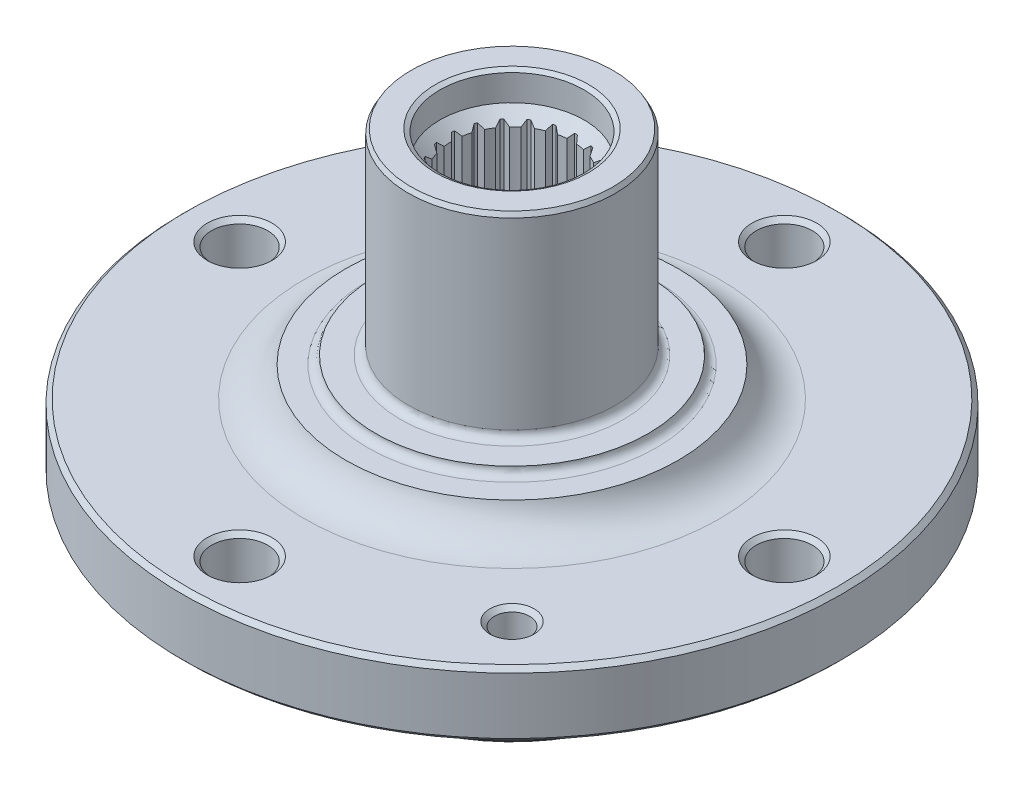
from build123d import *
from OCP.BRepFilletAPI import BRepFilletAPI_MakeChamfer

# Parameters (mm, degrees)
SKETCH2_R          = 5.15
SKETCH2_R_2        = 3.25
CUT_EXTRUDE1_DEPTH = 20
CHAMFER6_SIZE      = 1
CHAMFER7_SIZE      = 2.5
CUT_EXTRUDE4_DEPTH = 100
CHAMFER1_SIZE      = 0.8
CHAMFER2_SIZE      = 0.8
FILLET1_R          = 2
FILLET2_R          = 1.5
CHAMFER3_SIZE      = 0.5
FILLET3_R          = 8
FILLET4_R          = 1.5
FILLET5_R          = 1.5
CHAMFER5_SIZE      = 0.8
CHAMFER5_SIZE2     = 0.461880215


# Some blends are built 0.0001 mm under size
with BuildPart() as part:
    # Sketch1 → Revolve1 (revolve)
    with BuildSketch(Plane.XY, mode=Mode.PRIVATE) as revolve1_sk:
        Polygon((13.25, 37.5), (13.25, 32.5), (11, 32.5), (11, -18.5), (25.5, -18.5), (25.5, -34.5), (28, -34.5), (28, -39.5), (29.5, -39.5), (29.5, -35), (30, -35), (30, -26), (30.25, -26), (30.25, -17.5), (60.5, -17.5), (60.5, -5.5), (30.5, -5.5), (30.5, 0), (25, 0), (25, 1.5), (19, 1.5), (19, 37.5), align=None)
    revolve(revolve1_sk.sketch.rotate(Axis((0, 72.237951583, 0), (0, -1, 0)), 180), axis=Axis((0, 72.237951583, 0), (0, -1, 0)))

    # Sketch2 → Cut-Extrude1 (cut)
    with BuildSketch(Plane.XZ.offset(17.5)):
        with Locations((-50, 0)):
            Circle(SKETCH2_R)
        with Locations((35.355339059, 35.355339059)):
            Circle(SKETCH2_R_2)
        with Locations((0, 50)):
            Circle(SKETCH2_R)
        with Locations((50, 0)):
            Circle(SKETCH2_R)
        with Locations((-35.355339059, -35.355339059)):
            Circle(SKETCH2_R_2)
        with Locations((0, -50)):
            Circle(SKETCH2_R)
    extrude(amount=-CUT_EXTRUDE1_DEPTH, mode=Mode.SUBTRACT)

    # Chamfer6
    chamfer6_edges = [part.edges().sort_by_distance(p)[0] for p in [
        (11, -18.5, 0),
    ]]
    chamfer(chamfer6_edges, length=CHAMFER6_SIZE)

    # Chamfer7
    # the kernel refuses this chamfer: 2.5 mm, written as the material it takes off along each edge
    with BuildSketch(Plane(origin=(0, 32.5, 0), x_dir=(-1, 0, 0), z_dir=(0, 0, 1))) as chamfer7_piece_1_section:
        Polygon((11, CHAMFER7_SIZE), (11 + CHAMFER7_SIZE, 0), (11, 0), align=None)
    chamfer7_piece_1 = revolve(axis=Axis((0, 32.5, 0), (0, -1, 0)), mode=Mode.PRIVATE)
    chamfer7_piece_1 = chamfer7_piece_1 & Plane(origin=(0, 31.134199325, 0), x_dir=(-1, 0, 0), z_dir=(0, -1, 0)) * Cylinder(13.25, 54, mode=Mode.PRIVATE)
    add(chamfer7_piece_1, mode=Mode.SUBTRACT)

    # Sketch3 → Cut-Extrude4 (cut)
    with BuildSketch(Plane.XZ.offset(18.5)):
        with BuildLine():
            Line((1.499612388, 11.654475596), (0.215435269, 10.491079369))
            ThreePointArc((0.215435269, 10.491079369), (1.563455316, 10.376109275), (2.885474644, 10.088635686))
            Line((2.885474644, 10.088635686), (2.001266969, 11.578863334))
            ThreePointArc((2.001266969, 11.578863334), (1.750847811, 11.619377243), (1.499612388, 11.654475596))
        make_face()
        with BuildLine():
            Line((4.868337941, 10.694643685), (3.298296151, 9.961451739))
            ThreePointArc((3.298296151, 9.961451739), (4.552539419, 9.45425356), (5.73109081, 8.789879578))
            Line((5.73109081, 8.789879578), (5.325418312, 10.47452538))
            ThreePointArc((5.325418312, 10.47452538), (5.098066258, 10.587051713), (4.868337941, 10.694643685))
        make_face()
        with BuildLine():
            Line((7.804485048, 8.784505125), (6.088083689, 8.546664781))
            ThreePointArc((6.088083689, 8.546664781), (7.137105161, 7.692305301), (8.067469151, 6.71006347))
            Line((8.067469151, 6.71006347), (8.176377611, 8.439439254))
            ThreePointArc((8.176377611, 8.439439254), (7.99229389, 8.613979552), (7.804485048, 8.784505125))
        make_face()
        with BuildLine():
            Line((10.047164153, 6.093784109), (8.336913018, 6.372428526))
            ThreePointArc((8.336913018, 6.372428526), (9.087502531, 5.246821334), (9.687012198, 4.033988151))
            Line((9.687012198, 4.033988151), (10.300824621, 5.654431289))
            ThreePointArc((10.300824621, 5.654431289), (10.176365879, 5.875476881), (10.047164153, 6.093784109))
        make_face()
        with BuildLine():
            Line((11.397103375, 2.861563007), (9.844965783, 3.631933407))
            ThreePointArc((9.844965783, 3.631933407), (10.230430166, 2.335093641), (10.445816444, 0.999434657))
            Line((10.445816444, 0.999434657), (11.509992904, 2.366961665))
            ThreePointArc((11.509992904, 2.366961665), (11.456217846, 2.61487168), (11.397103375, 2.861563007))
        make_face()
        with BuildLine():
            Line((11.73435469, -0.62496115), (10.478244879, 0.56868444))
            ThreePointArc((10.478244879, 0.56868444), (10.464333929, -0.784157995), (10.276458802, -2.123963618))
            Line((10.276458802, -2.123963618), (11.696442549, -1.130863515))
            ThreePointArc((11.696442549, -1.130863515), (11.718129326, -0.878116971), (11.73435469, -0.62496115))
        make_face()
        with BuildLine():
            Line((11.02895184, -4.055995392), (10.180480677, -2.54513526))
            ThreePointArc((10.180480677, -2.54513526), (9.768430444, -3.833774377), (9.193987442, -5.058679029))
            Line((9.193987442, -5.058679029), (10.843606689, -4.528247135))
            ThreePointArc((10.843606689, -4.528247135), (10.938828335, -4.2931217), (11.02895184, -4.055995392))
        make_face()
        with BuildLine():
            Line((9.343572963, -7.12667727), (8.978130835, -5.432849148))
            ThreePointArc((8.978130835, -5.432849148), (8.20455379, -6.542783707), (7.294584694, -7.543949235))
            Line((7.294584694, -7.543949235), (9.027263532, -7.52331675))
            ThreePointArc((9.027263532, -7.52331675), (9.187559186, -7.326704352), (9.343572963, -7.12667727))
        make_face()
        with BuildLine():
            Line((6.827971368, -9.564163222), (6.978029411, -7.837871173))
            ThreePointArc((6.978029411, -7.837871173), (5.91166127, -8.670478617), (4.747020828, -9.35894707))
            Line((4.747020828, -9.35894707), (6.408803138, -9.849947282))
            ThreePointArc((6.408803138, -9.849947282), (6.619929828, -9.709317794), (6.827971368, -9.564163222))
        make_face()
        with BuildLine():
            Line((3.705669296, -11.151871926), (4.357894196, -9.546504574))
            ThreePointArc((4.357894196, -9.546504574), (3.093486447, -10.027804077), (1.777658073, -10.342402012))
            Line((1.777658073, -10.342402012), (3.220887205, -11.301407397))
            ThreePointArc((3.220887205, -11.301407397), (3.464085398, -11.229256367), (3.705669296, -11.151871926))
        make_face()
        with BuildLine():
            Line((0.25409699, -11.748728495), (1.350535701, -10.406929774))
            ThreePointArc((1.350535701, -10.406929774), (0.000436521, -10.494155764), (-1.349662659, -10.406929774))
            Line((-1.349662659, -10.406929774), (-0.253223947, -11.748728495))
            ThreePointArc((-0.253223947, -11.748728495), (0.000436521, -11.751466858), (0.25409699, -11.748728495))
        make_face()
        with BuildLine():
            Line((-3.220058206, -11.301699604), (-1.776829074, -10.342694219))
            ThreePointArc((-1.776829074, -10.342694219), (-3.092657447, -10.028096284), (-4.357065197, -9.54679678))
            Line((-4.357065197, -9.54679678), (-3.704840297, -11.152164132))
            ThreePointArc((-3.704840297, -11.152164132), (-3.463256398, -11.229548574), (-3.220058206, -11.301699604))
        make_face()
        with BuildLine():
            Line((-6.408102355, -9.850505732), (-4.746320045, -9.35950552))
            ThreePointArc((-4.746320045, -9.35950552), (-5.910960486, -8.671037067), (-6.977328628, -7.838429623))
            Line((-6.977328628, -7.838429623), (-6.827270584, -9.564721672))
            ThreePointArc((-6.827270584, -9.564721672), (-6.619229045, -9.709876244), (-6.408102355, -9.850505732))
        make_face()
        with BuildLine():
            Line((-9.026763745, -7.524091822), (-7.294084907, -7.544724307))
            ThreePointArc((-7.294084907, -7.544724307), (-8.204054002, -6.543558779), (-8.977631047, -5.43362422))
            Line((-8.977631047, -5.43362422), (-9.343073175, -7.127452342))
            ThreePointArc((-9.343073175, -7.127452342), (-9.187059399, -7.327479424), (-9.026763745, -7.524091822))
        make_face()
        with BuildLine():
            Line((-10.843362819, -4.529169961), (-9.193743572, -5.059601855))
            ThreePointArc((-9.193743572, -5.059601855), (-9.768186574, -3.834697203), (-10.180236807, -2.546058086))
            Line((-10.180236807, -2.546058086), (-11.02870797, -4.056918218))
            ThreePointArc((-11.02870797, -4.056918218), (-10.938584465, -4.294044526), (-10.843362819, -4.529169961))
        make_face()
        with BuildLine():
            Line((-11.696486777, -1.131852098), (-10.27650303, -2.1249522))
            ThreePointArc((-10.27650303, -2.1249522), (-10.464378157, -0.785146578), (-10.478289107, 0.567695858))
            Line((-10.478289107, 0.567695858), (-11.734398918, -0.625949733))
            ThreePointArc((-11.734398918, -0.625949733), (-11.718173554, -0.879105553), (-11.696486777, -1.131852098))
        make_face()
        with BuildLine():
            Line((-11.510331813, 2.365995166), (-10.446155353, 0.998468158))
            ThreePointArc((-10.446155353, 0.998468158), (-10.230769075, 2.334127141), (-9.845304693, 3.630966907))
            Line((-9.845304693, 3.630966907), (-11.397442284, 2.860596508))
            ThreePointArc((-11.397442284, 2.860596508), (-11.456556755, 2.61390518), (-11.510331813, 2.365995166))
        make_face()
        with BuildLine():
            Line((-10.301438611, 5.653572751), (-9.687626187, 4.033129613))
            ThreePointArc((-9.687626187, 4.033129613), (-9.088116521, 5.245962796), (-8.337527008, 6.371569988))
            Line((-8.337527008, 6.371569988), (-10.047778142, 6.092925571))
            ThreePointArc((-10.047778142, 6.092925571), (-10.176979869, 5.874618343), (-10.301438611, 5.653572751))
        make_face()
        with BuildLine():
            Line((-8.177222637, 8.438764962), (-8.068314177, 6.709389178))
            ThreePointArc((-8.068314177, 6.709389178), (-7.137950187, 7.691631009), (-6.088928715, 8.545990489))
            Line((-6.088928715, 8.545990489), (-7.805330075, 8.783830833))
            ThreePointArc((-7.805330075, 8.783830833), (-7.993138916, 8.61330526), (-8.177222637, 8.438764962))
        make_face()
        with BuildLine():
            Line((-5.326429804, 10.474095247), (-5.732102302, 8.789449445))
            ThreePointArc((-5.732102302, 8.789449445), (-4.553550911, 9.453823427), (-3.299307643, 9.961021606))
            Line((-3.299307643, 9.961021606), (-4.869349433, 10.694213552))
            ThreePointArc((-4.869349433, 10.694213552), (-5.09907775, 10.58662158), (-5.326429804, 10.474095247))
        make_face()
        with BuildLine():
            Line((-2.002365563, 11.57871558), (-2.886573238, 10.088487932))
            ThreePointArc((-2.886573238, 10.088487932), (-1.56455391, 10.375961521), (-0.216533863, 10.490931615))
            Line((-0.216533863, 10.490931615), (-1.500710982, 11.654327842))
            ThreePointArc((-1.500710982, 11.654327842), (-1.751946405, 11.619229489), (-2.002365563, 11.57871558))
        make_face()
    extrude(amount=-CUT_EXTRUDE4_DEPTH, mode=Mode.SUBTRACT)

    # Chamfer1
    chamfer1_edges = [part.edges().sort_by_distance(p)[0] for p in [
        (-55.15, -5.5, 0),
        (-55.15, -17.5, 0),
        (32.105339059, -5.5, 35.355339059),
        (-38.605339059, -5.5, -35.355339059),
        (-38.605339059, -17.5, -35.355339059),
        (-5.15, -5.5, 50),
        (-5.15, -17.5, 50),
        (44.85, -5.5, 0),
        (44.85, -17.5, 0),
        (-5.15, -5.5, -50),
        (-5.15, -17.5, -50),
    ]]
    chamfer(chamfer1_edges, length=CHAMFER1_SIZE)

    # Chamfer2
    chamfer2_edges = [part.edges().sort_by_distance(p)[0] for p in [
        (60.5, -5.5, 0),
        (60.5, -17.5, 0),
    ]]
    chamfer(chamfer2_edges, length=CHAMFER2_SIZE)

    # Fillet1
    fillet1_edges = [part.edges().sort_by_distance(p)[0] for p in [
        (30.25, -17.5, 0),
    ]]
    fillet(fillet1_edges, radius=FILLET1_R)

    # Fillet2
    fillet2_edges = [part.edges().sort_by_distance(p)[0] for p in [
        (28, -34.5, 0),
        (25.5, -18.5, 0),
    ]]
    fillet(fillet2_edges, radius=FILLET2_R)

    # Chamfer3
    chamfer3_edges = [part.edges().sort_by_distance(p)[0] for p in [
        (29.5, -39.5, 0),
        (28, -39.5, 0),
    ]]
    chamfer(chamfer3_edges, length=CHAMFER3_SIZE)

    # Fillet3
    # the kernel refuses this fillet: 8 mm, written as the material it adds along each edge
    with BuildSketch(Plane(origin=(0, -5.5, 0), x_dir=(-1, 0, 0), z_dir=(0, 0, 1))) as fillet3_piece_1:
        with BuildLine():
            CenterArc((38.099342077, -8), FILLET3_R, 90, 71.790043136)
            Line((30.5, -5.5), (30.348013158, -5.45))
            ThreePointArc((30.348013158, -5.45), (30.34, -2.75), (30.34, 0))
            Line((30.34, 0), (30.5, 0.16))
            Line((30.5, 0.16), (38.099342077, 0.16))
            Line((38.099342077, 0.16), (38.099342077, 0))
        make_face()
    revolve(axis=Axis((0, -5.5, 0), (0, -1, 0)))

    # Fillet4
    fillet4_edges = [part.edges().sort_by_distance(p)[0] for p in [
        (25, 0, 0),
    ]]
    fillet(fillet4_edges, radius=FILLET4_R - 0.0001)  # a hair under: the kernel refuses the full size

    # Fillet5
    fillet5_edges = [part.edges().sort_by_distance(p)[0] for p in [
        (19, 1.5, 0),
    ]]
    fillet(fillet5_edges, radius=FILLET5_R)

    # Chamfer5: one chamfer whose edges measure the first distance from different faces: ONE call of the kernel's chamfer builder (chamfer() names one face for all edges)
    chamfer5_edges_1 = [part.edges().sort_by_distance(p)[0] for p in [
        (19, 37.5, 0),
    ]]
    chamfer5_side_1 = [part.faces().sort_by_distance(p)[0] for p in [
        (19, 20.25, 0),
    ]]
    chamfer5_edges_2 = [part.edges().sort_by_distance(p)[0] for p in [
        (13.25, 37.5, 0),
    ]]
    chamfer5_side_2 = [part.faces().sort_by_distance(p)[0] for p in [
        (18.462598846, 37.5, 0),
    ]]
    chamfer5 = BRepFilletAPI_MakeChamfer(part.part.solid().wrapped)
    for e in chamfer5_edges_1:
        chamfer5.Add(CHAMFER5_SIZE, CHAMFER5_SIZE2, e.wrapped, chamfer5_side_1[0].wrapped)  # the first distance lies on this face
    for e in chamfer5_edges_2:
        chamfer5.Add(CHAMFER5_SIZE, CHAMFER5_SIZE2, e.wrapped, chamfer5_side_2[0].wrapped)  # the first distance lies on this face
    add(Compound.cast(chamfer5.Shape()), mode=Mode.REPLACE)


solid = part.part
